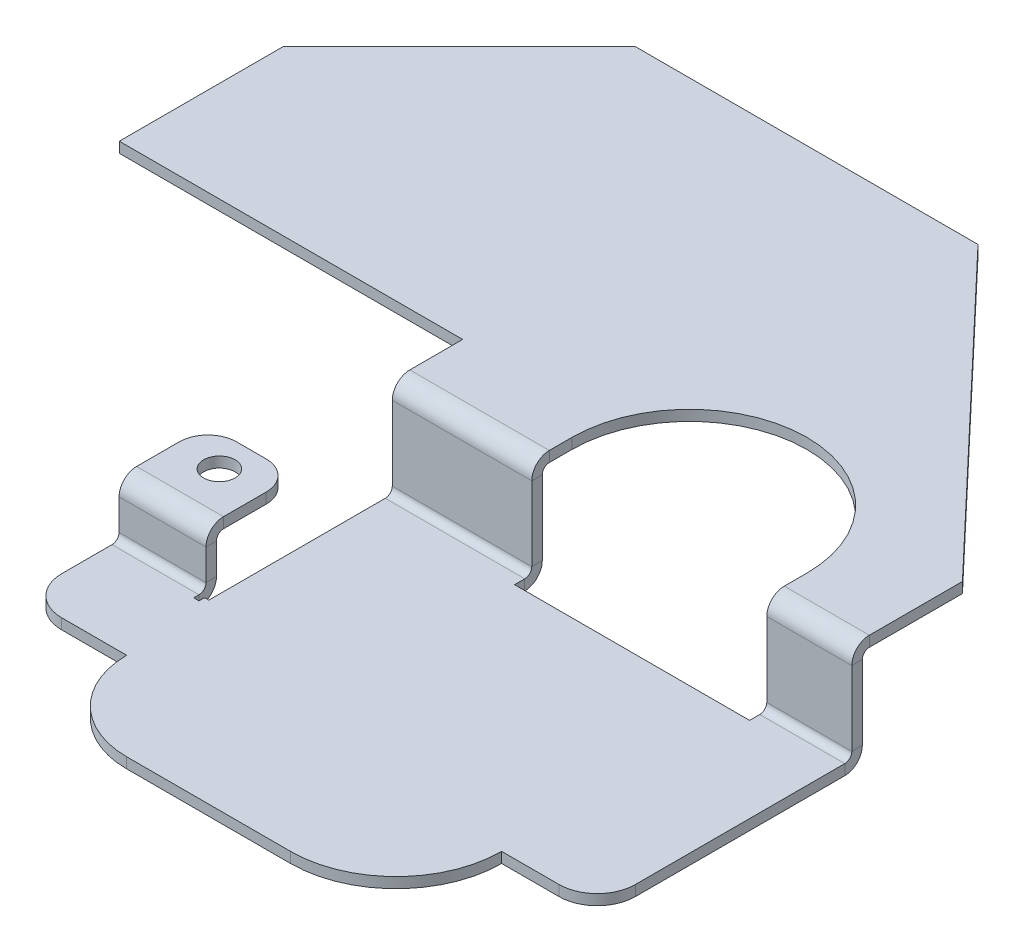
from build123d import *

# Parameters (mm, degrees)
BASE_FLANGE1_DEPTH            = 1.1
EDGE_FLANGE1_STRIP_W          = 5.8732
EDGE_FLANGE1_STRIP_H          = 1.1
EDGE_FLANGE1_STRIP_CUT_DEPTH  = 9.1
EDGE_FLANGE1_RELIEF_W         = 6.4232
EDGE_FLANGE1_RELIEF_H         = 0.55
EDGE_FLANGE1_RELIEF_CUT_DEPTH = 1.1
EDGE_FLANGE1_DEPTH            = 9.1
EDGE_FLANGE2_STRIP_W          = 5.8732
EDGE_FLANGE2_STRIP_H          = 1.1
EDGE_FLANGE2_STRIP_CUT_DEPTH  = 9.1
EDGE_FLANGE2_DEPTH            = 9.1
SKETCH9_R                     = 1.65
EXTRUDE1_DEPTH                = 1.1
SKETCHED_START                = -55.937504649
SKETCHED_BEND2_DEPTH          = 84.037504649
SKETCHED_START_2              = -37.556301802
SKETCHED_BEND2_2_OUTLINE_W    = 35.581961475
SKETCHED_BEND2_2_OUTLINE_H    = 1.1
SKETCHED_BEND2_2_DEPTH        = 32.156301802
SKETCHED_START_3              = -20
SKETCHED_BEND2_3_DEPTH        = 14.6
SKETCHED_START_4              = 19.2
SKETCHED_BEND2_4_DEPTH        = 8.9
SKETCHED_START_5              = -19.700000012
SKETCHED_BEND2_5_DEPTH        = 1.100000011
SKETCHED_BEND5_DEPTH          = 84.037504649
SKETCHED_BEND5_2_OUTLINE_W    = 1.1
SKETCHED_BEND5_2_OUTLINE_H    = 35.581961474
SKETCHED_BEND5_2_DEPTH        = 32.156301802
SKETCHED_BEND5_3_DEPTH        = 14.6
SKETCHED_BEND5_4_DEPTH        = 8.9
SKETCHED_START_6              = 10.352213433
SKETCHED_BEND5_5_DEPTH        = 1.1


with BuildPart() as part:
    # Base-Flange1: sheet metal written as solids
    # Sketch1 → Base-Flange1 (new body)
    with BuildSketch(Plane(origin=(0, 0, 0), x_dir=(1, 0, 0), z_dir=(0, 1, 0))):
        with BuildLine():
            Line((-30.1, 1.2), (-21, 1.2))
            Line((-21, 1.2), (-21, -0.6))
            Line((-21, -0.6), (-20, -0.6))
            Line((-20, -0.6), (-20, 19.7))
            Line((-20, 19.7), (-20, 32.054788892))
            Line((-20, 32.054788892), (-20, 35.211930536))
            Line((-20, 35.211930536), (-55.937504649, 35.211930536))
            Line((-55.937504649, 35.211930536), (-55.937504649, 52.412689164))
            Line((-55.937504649, 52.412689164), (-37.556301802, 70.793892011))
            Line((-37.556301802, 70.793892011), (-1.637070551, 70.793892011))
            Line((-1.637070551, 70.793892011), (28.1, 39.427802749))
            Line((28.1, 39.427802749), (28.1, 32.054788892))
            Line((28.1, 32.054788892), (28.1, 19.7))
            Line((28.1, 19.7), (28.1, -4.05))
            ThreePointArc((28.1, -4.05), (26.928427125, -6.878427125), (24.1, -8.05))
            Line((24.1, -8.05), (18.1, -8.05))
            ThreePointArc((18.1, -8.05), (14.863529932, -15.863529932), (7.05, -19.1))
            Line((7.05, -19.1), (-10.1, -19.1))
            ThreePointArc((-10.1, -19.1), (-16.605382387, -16.405382387), (-19.3, -9.9))
            Line((-19.3, -9.9), (-26.1, -9.9))
            ThreePointArc((-26.1, -9.9), (-28.928427125, -8.728427125), (-30.1, -5.9))
            Line((-30.1, -5.9), (-30.1, 1.2))
        make_face()
        with BuildLine():
            Line((-5.4, 19.7), (-5.4, 16.8))
            Line((-5.4, 16.8), (19.2, 16.8))
            Line((19.2, 16.8), (19.2, 19.7))
            Line((19.2, 19.7), (19.2, 32.054788892))
            ThreePointArc((19.2, 32.054788892), (6.9, 44.354788892), (-5.4, 32.054788892))
            Line((-5.4, 32.054788892), (-5.4, 19.7))
        make_face(mode=Mode.SUBTRACT)
    extrude(amount=BASE_FLANGE1_DEPTH)

    # Edge-Flange1: sheet metal written as solids
    # Edge-Flange1 strip (on a plane across the edge) → Edge-Flange1 strip cut (cut)
    with BuildSketch(Plane(origin=(-21, 1.1, -1.2), x_dir=(0, 0, 1), z_dir=(-1, 0, 0))):
        with Locations((-1.1, -0.55)):
            Rectangle(EDGE_FLANGE1_STRIP_W, EDGE_FLANGE1_STRIP_H)
    extrude(amount=EDGE_FLANGE1_STRIP_CUT_DEPTH, mode=Mode.SUBTRACT)

    # Edge-Flange1 relief (on the sheet) → Edge-Flange1 relief cut (cut)
    with BuildSketch(Plane(origin=(-21, 1.1, 0.6366), x_dir=(0, 0, 1), z_dir=(0, 1, 0))):
        with Locations((-2.6616, 0.275)):
            Rectangle(EDGE_FLANGE1_RELIEF_W, EDGE_FLANGE1_RELIEF_H)
    extrude(amount=-EDGE_FLANGE1_RELIEF_CUT_DEPTH, mode=Mode.SUBTRACT)

    # Edge-Flange1 section (on a plane across the edge) → Edge-Flange1 (add)
    with BuildSketch(Plane(origin=(-21, 1.1, -1.2), x_dir=(0, 0, 1), z_dir=(-1, 0, 0))):
        with BuildLine():
            Line((0, 0.7366), (0, 5.8))
            Line((0, 5.8), (1.1, 5.8))
            Line((1.1, 5.8), (1.1, 0.7366))
            ThreePointArc((1.1, 0.7366), (1.315745145, 0.215745145), (1.8366, 0))
            Line((1.8366, 0), (1.8366, -1.1))
            ThreePointArc((1.8366, -1.1), (0.537927686, -0.562072314), (0, 0.7366))
        make_face()
    extrude(amount=EDGE_FLANGE1_DEPTH)

    # Edge-Flange2: sheet metal written as solids
    # Edge-Flange2 strip (on a plane across the edge) → Edge-Flange2 strip cut (cut)
    with BuildSketch(Plane(origin=(-30.1, 6.9, -1.2), x_dir=(0, -1, 0), z_dir=(1, 0, 0))):
        with Locations((-1.1, -0.55)):
            Rectangle(EDGE_FLANGE2_STRIP_W, EDGE_FLANGE2_STRIP_H)
    extrude(amount=EDGE_FLANGE2_STRIP_CUT_DEPTH, mode=Mode.SUBTRACT)

    # Edge-Flange2 section (on a plane across the edge) → Edge-Flange2 (add)
    with BuildSketch(Plane(origin=(-30.1, 6.9, -1.2), x_dir=(0, -1, 0), z_dir=(1, 0, 0))):
        with BuildLine():
            Line((0, 0.7366), (0, 8.2))
            Line((0, 8.2), (1.1, 8.2))
            Line((1.1, 8.2), (1.1, 0.7366))
            ThreePointArc((1.1, 0.7366), (1.315745145, 0.215745145), (1.8366, 0))
            Line((1.8366, 0), (1.8366, -1.1))
            ThreePointArc((1.8366, -1.1), (0.537927686, -0.562072314), (0, 0.7366))
        make_face()
    extrude(amount=EDGE_FLANGE2_DEPTH)

    # Sketch9 → Extrude1 (cut)
    with BuildSketch(Plane(origin=(0, 6.9, 0), x_dir=(1, 0, 0), z_dir=(0, 1, 0))):
        with Locations(Location((-25.55, 6.05, 0), (0, 0, 270))):
            Circle(SKETCH9_R)
        with BuildLine():
            Line((-30.1, 6.4), (-30.1, 9.4))
            Line((-30.1, 9.4), (-27.1, 9.4))
            ThreePointArc((-27.1, 9.4), (-29.221320344, 8.521320344), (-30.1, 6.4))
        make_face()
        with BuildLine():
            Line((-24, 9.4), (-21, 9.4))
            Line((-21, 9.4), (-21, 6.4))
            ThreePointArc((-21, 6.4), (-21.878679656, 8.521320344), (-24, 9.4))
        make_face()
    extrude(amount=-EXTRUDE1_DEPTH, mode=Mode.SUBTRACT)

    # Sketched Bend2: read off the stored shape, not the designer's step
    # Sketched Bend2 outline → Sketched Bend2 (cut)
    with BuildSketch(Plane.YZ.offset(SKETCHED_START)):
        with BuildLine():
            ThreePointArc((1.1, -19.545814945), (0.299404636, -18.868452246), (-1.3e-08, -17.8634))
            Line((-1.3e-08, -17.8634), (0, -70.793892011))
            Line((0, -70.793892011), (1.1, -70.793892011))
            Line((1.1, -70.793892011), (1.1, -19.545814945))
        make_face()
    extrude(amount=SKETCHED_BEND2_DEPTH, mode=Mode.SUBTRACT)



with BuildPart() as body_2:
    # Sketched Bend2 2 outline → Sketched Bend2 2 (new body)
    with BuildSketch(Plane.YZ.offset(SKETCHED_START_2)):
        with Locations((34.95512472, -19.15)):
            Rectangle(SKETCHED_BEND2_2_OUTLINE_W, SKETCHED_BEND2_2_OUTLINE_H)
    extrude(amount=SKETCHED_BEND2_2_DEPTH)


with BuildPart() as part_1:
    add(part.part)

    add(body_2.part)  # Sketched Bend2 3 merges body 2
    # Sketched Bend2 3 outline → Sketched Bend2 3 (add)
    with BuildSketch(Plane.YZ.offset(SKETCHED_START_3)):
        with BuildLine():
            Line((17.164143982, -18.6), (1.836600013, -18.600000013))
            ThreePointArc((1.836600013, -18.600000013), (1.315745141, -18.384254868), (1.099999987, -17.8634))
            Line((1.099999987, -17.8634), (1.1, -19.545814945))
            ThreePointArc((1.1, -19.545814945), (1.460317993, -19.661040525), (1.8366, -19.700000013))
            Line((1.8366, -19.700000013), (17.164143982, -19.7))
            Line((17.164143982, -19.7), (17.164143982, -18.6))
        make_face()
    extrude(amount=SKETCHED_BEND2_3_DEPTH)

    # Sketched Bend2 4 outline → Sketched Bend2 4 (add)
    with BuildSketch(Plane.YZ.offset(SKETCHED_START_4)):
        with BuildLine():
            Line((17.164143982, -18.6), (1.836600013, -18.600000013))
            ThreePointArc((1.836600013, -18.600000013), (1.315745141, -18.384254868), (1.099999987, -17.8634))
            Line((1.099999987, -17.8634), (1.1, -19.545814945))
            ThreePointArc((1.1, -19.545814945), (1.460317993, -19.661040525), (1.8366, -19.700000013))
            Line((1.8366, -19.700000013), (17.164143982, -19.7))
            Line((17.164143982, -19.7), (17.164143982, -18.6))
        make_face()
    extrude(amount=SKETCHED_BEND2_4_DEPTH)

    # Sketched Bend2 5 outline → Sketched Bend2 5 (add)
    with BuildSketch(Plane.XY.offset(SKETCHED_START_5)):
        Polygon((-37.556301802, 17.164143982), (-37.556301802, 52.746105457), (-55.937504649, 34.36490261), (-55.937504649, 17.164143982), align=None)
        with BuildLine():
            Line((28.1, 17.164143982), (28.1, 21.380016195))
            Line((28.1, 21.380016195), (-1.637070551, 52.746105457))
            Line((-1.637070551, 52.746105457), (-5.4, 52.746105457))
            Line((-5.4, 52.746105457), (-5.4, 14.007002338))
            ThreePointArc((-5.4, 14.007002338), (6.9, 26.307002338), (19.2, 14.007002338))
            Line((19.2, 14.007002338), (19.2, 17.164143982))
            Line((19.2, 17.164143982), (28.1, 17.164143982))
        make_face()
    extrude(amount=SKETCHED_BEND2_5_DEPTH)

    # Sketched Bend5: read off the stored shape, not the designer's step
    # Sketched Bend5 outline → Sketched Bend5 (cut)
    with BuildSketch(Plane.YZ.offset(SKETCHED_START)):
        with BuildLine():
            ThreePointArc((9.615613433, -18.599999993), (10.620665676, -18.89940464), (11.298028372, -19.7))
            Line((11.298028372, -19.7), (52.746105457, -19.7))
            Line((52.746105457, -19.7), (52.746105457, -18.6))
            Line((52.746105457, -18.6), (9.615613433, -18.599999993))
        make_face()
    extrude(amount=SKETCHED_BEND5_DEPTH, mode=Mode.SUBTRACT)



with BuildPart() as body_2_2:
    # Sketched Bend5 2 outline → Sketched Bend5 2 (new body)
    with BuildSketch(Plane.YZ.offset(SKETCHED_START_2)):
        with Locations((10.902213433, -43.755124732)):
            Rectangle(SKETCHED_BEND5_2_OUTLINE_W, SKETCHED_BEND5_2_OUTLINE_H)
    extrude(amount=SKETCHED_BEND5_2_DEPTH)


with BuildPart() as part_2:
    add(part_1.part)

    add(body_2_2.part)  # Sketched Bend5 3 merges body 2 2
    # Sketched Bend5 3 outline → Sketched Bend5 3 (add)
    with BuildSketch(Plane.YZ.offset(SKETCHED_START_3)):
        with BuildLine():
            ThreePointArc((11.45221344, -20.4366), (11.413253953, -20.060317993), (11.298028372, -19.7))
            Line((11.298028372, -19.7), (9.615613433, -19.699999993))
            ThreePointArc((9.615613433, -19.699999993), (10.136468293, -19.91574514), (10.35221344, -20.4366))
            Line((10.35221344, -20.4366), (10.352213433, -25.964143995))
            Line((10.352213433, -25.964143995), (11.452213433, -25.964143995))
            Line((11.452213433, -25.964143995), (11.45221344, -20.4366))
        make_face()
    extrude(amount=SKETCHED_BEND5_3_DEPTH)

    # Sketched Bend5 4 outline → Sketched Bend5 4 (add)
    with BuildSketch(Plane.YZ.offset(SKETCHED_START_4)):
        with BuildLine():
            ThreePointArc((11.45221344, -20.4366), (11.413253953, -20.060317993), (11.298028372, -19.7))
            Line((11.298028372, -19.7), (9.615613433, -19.699999993))
            ThreePointArc((9.615613433, -19.699999993), (10.136468293, -19.91574514), (10.35221344, -20.4366))
            Line((10.35221344, -20.4366), (10.352213433, -25.964143995))
            Line((10.352213433, -25.964143995), (11.452213433, -25.964143995))
            Line((11.452213433, -25.964143995), (11.45221344, -20.4366))
        make_face()
    extrude(amount=SKETCHED_BEND5_4_DEPTH)

    # Sketched Bend5 5 outline → Sketched Bend5 5 (add)
    with BuildSketch(Plane(origin=(0, 0, 0), x_dir=(1, 0, 0), z_dir=(0, 1, 0)).offset(SKETCHED_START_6)):
        Polygon((-37.556301802, 25.964143995), (-37.556301802, 61.546105469), (-55.937504649, 43.164902622), (-55.937504649, 25.964143995), align=None)
        with BuildLine():
            Line((28.1, 25.964143995), (28.1, 30.180016207))
            Line((28.1, 30.180016207), (-1.637070551, 61.546105469))
            Line((-1.637070551, 61.546105469), (-5.4, 61.546105469))
            Line((-5.4, 61.546105469), (-5.4, 22.80700235))
            ThreePointArc((-5.4, 22.80700235), (6.9, 35.10700235), (19.2, 22.80700235))
            Line((19.2, 22.80700235), (19.2, 25.964143995))
            Line((19.2, 25.964143995), (28.1, 25.964143995))
        make_face()
    extrude(amount=SKETCHED_BEND5_5_DEPTH)


solid = part_2.part
